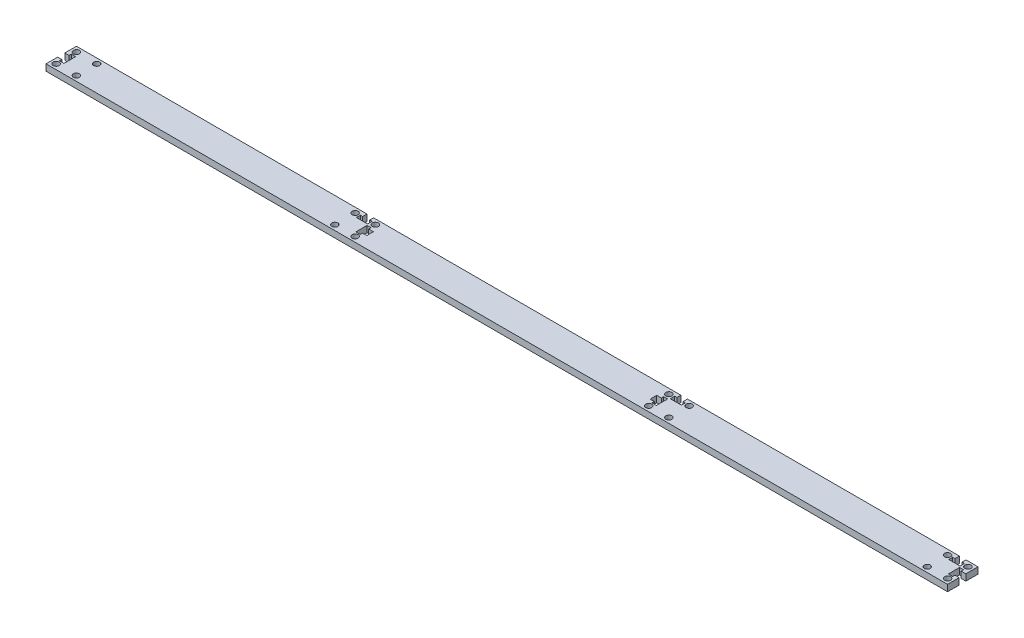
from build123d import *

# Parameters (mm, degrees)
SKETCH1_R           = 1.5
BOSS_EXTRUDE1_DEPTH = 3.175
CUT_EXTRUDE2_DEPTH  = 10
SKETCH6_W           = 2.65
SKETCH6_H           = 3.175
CUT_EXTRUDE3_DEPTH  = 0.25
CUT_EXTRUDE4_DEPTH  = 10


with BuildPart() as part:
    # Sketch1 → Boss-Extrude1 (new body)
    with BuildSketch(Plane(origin=(0, 0, 0), x_dir=(1, 0, 0), z_dir=(0, 1, 0))):
        Polygon((0, 7.5), (0, 0), (444.5, 0), (444.5, 15), (0, 15), align=None)
        with Locations((2.5, 2.5)):
            Circle(SKETCH1_R, mode=Mode.SUBTRACT)
        with Locations((12.5, 2.5)):
            Circle(SKETCH1_R, mode=Mode.SUBTRACT)
        with Locations((2.5, 12.5)):
            Circle(SKETCH1_R, mode=Mode.SUBTRACT)
        with Locations((12.5, 12.5)):
            Circle(SKETCH1_R, mode=Mode.SUBTRACT)
        with Locations((139.9, 2.5)):
            Circle(SKETCH1_R, mode=Mode.SUBTRACT)
        with Locations((149.9, 2.5)):
            Circle(SKETCH1_R, mode=Mode.SUBTRACT)
        with Locations((139.9, 12.5)):
            Circle(SKETCH1_R, mode=Mode.SUBTRACT)
        with Locations((149.9, 12.5)):
            Circle(SKETCH1_R, mode=Mode.SUBTRACT)
        with Locations((442, 12.5)):
            Circle(SKETCH1_R, mode=Mode.SUBTRACT)
        with Locations((294.6, 2.5)):
            Circle(SKETCH1_R, mode=Mode.SUBTRACT)
        with Locations((304.6, 2.5)):
            Circle(SKETCH1_R, mode=Mode.SUBTRACT)
        with Locations((432, 2.5)):
            Circle(SKETCH1_R, mode=Mode.SUBTRACT)
        with Locations((442, 2.5)):
            Circle(SKETCH1_R, mode=Mode.SUBTRACT)
        with Locations((294.6, 12.5)):
            Circle(SKETCH1_R, mode=Mode.SUBTRACT)
        with Locations((304.6, 12.5)):
            Circle(SKETCH1_R, mode=Mode.SUBTRACT)
        with Locations((432, 12.5)):
            Circle(SKETCH1_R, mode=Mode.SUBTRACT)
    extrude(amount=BOSS_EXTRUDE1_DEPTH)

    # Sketch4 → Cut-Extrude2 (cut)
    with BuildSketch(Plane(origin=(0, 3.175, 0), x_dir=(1, 0, 0), z_dir=(0, 1, 0))):
        Polygon((444.5, 5.75), (444.5, 9), (442.2, 9), (442.2, 10.15), (440.5, 10.15), (440.5, 7.5), (440.25, 7.5), (440.25, 4.6), (442.45, 4.6), (442.45, 5.75), align=None)
        Polygon((2.05, 9.25), (0, 9.25), (0, 5.75), (2.05, 5.75), (2.05, 4.6), (4.25, 4.6), (4.25, 10.4), (2.05, 10.4), align=None)
    extrude(amount=-CUT_EXTRUDE2_DEPTH, mode=Mode.SUBTRACT)

    # Sketch6 → Cut-Extrude3 (cut)
    with BuildSketch(Plane(origin=(440.5, 0, 0), x_dir=(0, 0, -1), z_dir=(1, 0, 0))):
        with Locations((8.825, 1.5875)):
            Rectangle(SKETCH6_W, SKETCH6_H)
    extrude(amount=-CUT_EXTRUDE3_DEPTH, mode=Mode.SUBTRACT)

    # Sketch7 → Cut-Extrude4 (cut)
    with BuildSketch(Plane(origin=(0, 3.175, 0), x_dir=(1, 0, 0), z_dir=(0, 1, 0))):
        Polygon((440.25, 10.15), (440.25, 4.6), (442.45, 4.6), (442.45, 5.75), (444.5, 5.75), (444.5, 9), (442.2, 9), (442.2, 10.15), align=None)
        Polygon((146.5, 13.1), (146.5, 15), (143.25, 15), (143.25, 12.85), (142.1, 12.85), (142.1, 10.9), (147.65, 10.9), (147.65, 13.1), align=None)
        Polygon((301.25, 12.85), (301.25, 15), (298, 15), (298, 13.1), (296.85, 13.1), (296.85, 10.9), (302.4, 10.9), (302.4, 12.85), align=None)
        Polygon((439.75, 10.9), (439.75, 13.1), (438.6, 13.1), (438.6, 15), (435.35, 15), (435.35, 12.85), (434.2, 12.85), (434.2, 10.9), align=None)
        Polygon((294.15, 5.75), (294.15, 4.6), (296.35, 4.6), (296.35, 10.15), (294.4, 10.15), (294.4, 9), (292.1, 9), (292.1, 5.75), align=None)
        Polygon((148.15, 10.15), (148.15, 4.6), (150.35, 4.6), (150.35, 5.75), (152.4, 5.75), (152.4, 9), (150.1, 9), (150.1, 10.15), align=None)
    extrude(amount=-CUT_EXTRUDE4_DEPTH, mode=Mode.SUBTRACT)


solid = part.part
